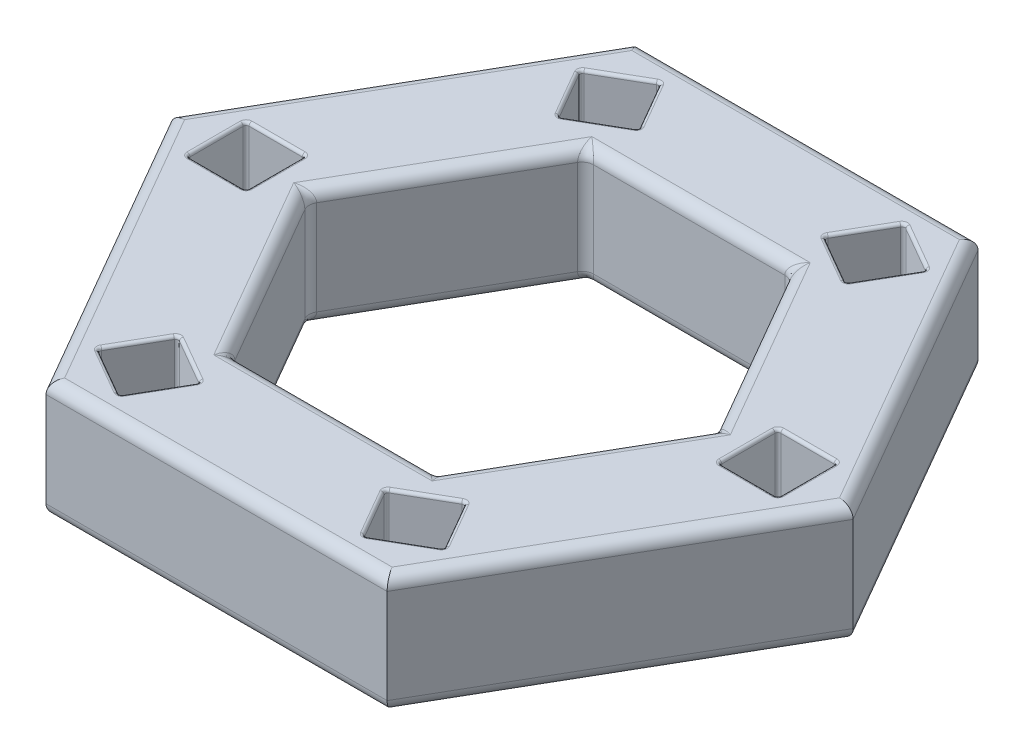
from build123d import *

# Parameters (mm, degrees)
BOSS_EXTRUDE1_DEPTH      = 10
FILLET1_R                = 1
FILLET2_R                = 1
SKETCH2_W                = 5
SKETCH2_H                = 5
CUT_EXTRUDE1_DEPTH       = 40.475730967
FILLET3_R                = 0.25
CIRPATTERN1_COUNT        = 6
FILLET3_OF_CIRPATTERN1_R = 0.25


with BuildPart() as part:
    # Sketch1 → Boss-Extrude1 (new body)
    with BuildSketch(Plane.XZ.offset(10)):
        Polygon((14.43375673, -25), (28.86751346, 0), (14.43375673, 25), (-14.43375673, 25), (-28.86751346, 0), (-14.43375673, -25), align=None)
        Polygon((-8.660254038, -15), (8.660254038, -15), (17.320508076, 0), (8.660254038, 15), (-8.660254038, 15), (-17.320508076, 0), align=None, mode=Mode.SUBTRACT)
    extrude(amount=-BOSS_EXTRUDE1_DEPTH)

    # Fillet1
    fillet1_edges = [part.edges().sort_by_distance(p)[0] for p in [
        (0, -10, -15),
        (12.990381057, -10, -7.5),
        (12.990381057, -10, 7.5),
        (0, -10, 15),
        (-12.990381057, -10, 7.5),
        (-12.990381057, -10, -7.5),
        (-21.650635095, -10, -12.5),
        (-21.650635095, -10, 12.5),
        (0, -10, 25),
        (21.650635095, -10, 12.5),
        (21.650635095, -10, -12.5),
        (0, -10, -25),
        (0, 0, 15),
        (12.990381057, 0, 7.5),
        (12.990381057, 0, -7.5),
        (0, 0, -15),
        (-12.990381057, 0, -7.5),
        (-12.990381057, 0, 7.5),
        (21.650635095, 0, -12.5),
        (21.650635095, 0, 12.5),
        (0, 0, 25),
        (-21.650635095, 0, 12.5),
        (-21.650635095, 0, -12.5),
        (0, 0, -25),
    ]]
    fillet(fillet1_edges, radius=FILLET1_R)

    # Fillet2
    fillet2_edges = [part.edges().sort_by_distance(p)[0] for p in [
        (-8.844181046, -0.268115848, 15.318570922),
        (-8.844181046, -9.731884152, 15.318570922),
        (8.844181046, -0.268115848, 15.318570922),
        (8.844181046, -9.731884152, 15.318570922),
        (17.688362091, -0.268115848, 0),
        (17.688362091, -9.731884152, 0),
        (8.844181046, -0.268115848, -15.318570922),
        (8.844181046, -9.731884152, -15.318570922),
        (-8.844181046, -0.268115848, -15.318570922),
        (-8.844181046, -9.731884152, -15.318570922),
        (-17.688362091, -0.268115848, 0),
        (-17.688362091, -9.731884152, 0),
        (-8.660254038, -5, 15),
        (8.660254038, -5, 15),
        (17.320508076, -5, 0),
        (8.660254038, -5, -15),
        (-8.660254038, -5, -15),
        (-17.320508076, -5, 0),
    ]]
    fillet(fillet2_edges, radius=FILLET2_R)

    # Sketch2 → Cut-Extrude1 (cut, through all)
    with BuildSketch(Plane(origin=(0, 0, 0), x_dir=(-1, 0, 0), z_dir=(0, 1, 0))):
        with Locations((-22.5, 0)):
            Rectangle(SKETCH2_W, SKETCH2_H)
    cut_extrude1 = extrude(amount=-CUT_EXTRUDE1_DEPTH, mode=Mode.SUBTRACT)

    # Fillet3
    fillet3_edges = [part.edges().sort_by_distance(p)[0] for p in [
        (25, 0, 0),
        (22.5, 0, -2.5),
        (22.5, 0, 2.5),
        (20, 0, 0),
        (25, -10, 0),
        (22.5, -10, -2.5),
        (22.5, -10, 2.5),
        (20, -10, 0),
        (20, -5, 2.5),
        (20, -5, -2.5),
        (25, -5, -2.5),
        (25, -5, 2.5),
    ]]
    fillet(fillet3_edges, radius=FILLET3_R)

    # CirPattern1: Cut-Extrude1 ×6 about axis
    cirpattern1_axis = Axis((0, 50, 0), (0, -1, 0))
    for i in range(1, CIRPATTERN1_COUNT):
        add(cut_extrude1.rotate(cirpattern1_axis, i * 360 / CIRPATTERN1_COUNT), mode=Mode.SUBTRACT)

    # Fillet3 of CirPattern1
    fillet3_of_cirpattern1_edges = [part.edges().sort_by_distance(p)[0] for p in [
        (12.5, 0, 21.650635095),
        (13.415063509, 0, 18.235571585),
        (9.084936491, 0, 20.735571585),
        (10, 0, 17.320508076),
        (12.5, -10, 21.650635095),
        (13.415063509, -10, 18.235571585),
        (9.084936491, -10, 20.735571585),
        (10, -10, 17.320508076),
        (7.834936491, -5, 18.570508076),
        (12.165063509, -5, 16.070508076),
        (14.665063509, -5, 20.400635095),
        (10.334936491, -5, 22.900635095),
        (-12.5, 0, 21.650635095),
        (-9.084936491, 0, 20.735571585),
        (-13.415063509, 0, 18.235571585),
        (-10, 0, 17.320508076),
        (-12.5, -10, 21.650635095),
        (-9.084936491, -10, 20.735571585),
        (-13.415063509, -10, 18.235571585),
        (-10, -10, 17.320508076),
        (-12.165063509, -5, 16.070508076),
        (-7.834936491, -5, 18.570508076),
        (-10.334936491, -5, 22.900635095),
        (-14.665063509, -5, 20.400635095),
        (-25, 0, 0),
        (-22.5, 0, 2.5),
        (-22.5, 0, -2.5),
        (-20, 0, 0),
        (-25, -10, 0),
        (-22.5, -10, 2.5),
        (-22.5, -10, -2.5),
        (-20, -10, 0),
        (-20, -5, -2.5),
        (-20, -5, 2.5),
        (-25, -5, 2.5),
        (-25, -5, -2.5),
        (-12.5, 0, -21.650635095),
        (-13.415063509, 0, -18.235571585),
        (-9.084936491, 0, -20.735571585),
        (-10, 0, -17.320508076),
        (-12.5, -10, -21.650635095),
        (-13.415063509, -10, -18.235571585),
        (-9.084936491, -10, -20.735571585),
        (-10, -10, -17.320508076),
        (-7.834936491, -5, -18.570508076),
        (-12.165063509, -5, -16.070508076),
        (-14.665063509, -5, -20.400635095),
        (-10.334936491, -5, -22.900635095),
        (12.5, 0, -21.650635095),
        (9.084936491, 0, -20.735571585),
        (13.415063509, 0, -18.235571585),
        (10, 0, -17.320508076),
        (12.5, -10, -21.650635095),
        (9.084936491, -10, -20.735571585),
        (13.415063509, -10, -18.235571585),
        (10, -10, -17.320508076),
        (12.165063509, -5, -16.070508076),
        (7.834936491, -5, -18.570508076),
        (10.334936491, -5, -22.900635095),
        (14.665063509, -5, -20.400635095),
    ]]
    fillet(fillet3_of_cirpattern1_edges, radius=FILLET3_OF_CIRPATTERN1_R)


solid = part.part
